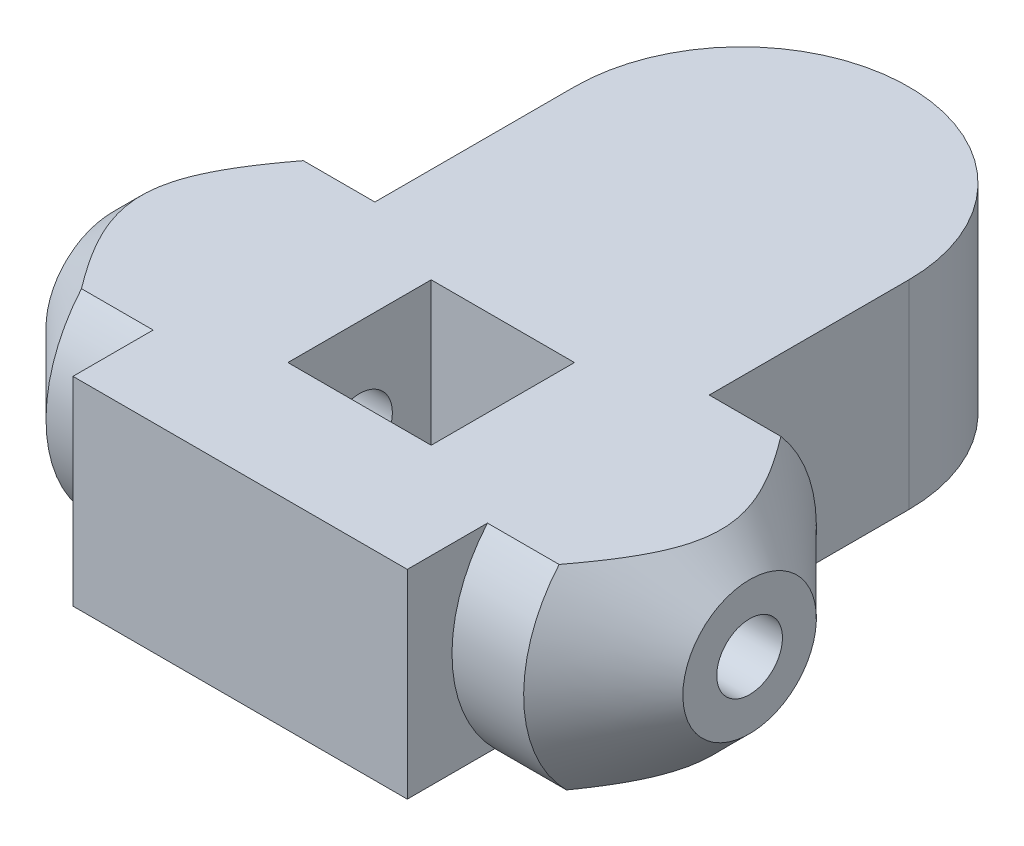
from build123d import *

# Parameters (mm, degrees)
BOSS_EXTRUDE1_DEPTH      = 12
BOSS_EXTRUDE1_DEPTH_BACK = 13
BOSS_EXTRUDE2_START      = -40
BOSS_EXTRUDE2_DEPTH      = 80
SKETCH2_W                = 18
SKETCH2_H                = 18
CUT_EXTRUDE1_DEPTH       = 20
CUT_EXTRUDE2_DEPTH       = 74.273460407
CUT_EXTRUDE2_DEPTH_BACK  = 74.273460407
SKETCH5_R                = 4.125
CHAMFER1_SIZE            = 10


# Read off the part's stored shape, not the designer's step: Boss-Extrude2
with BuildPart() as part:
    # Sketch1 → Boss-Extrude1 (new, two sides: drawn at the far end of the back side and taken through both)
    with BuildSketch(Plane(origin=(0, 0, 0), x_dir=(1, 0, 0), z_dir=(0, 1, 0)).offset(-BOSS_EXTRUDE1_DEPTH_BACK)):
        with BuildLine():
            Line((-21, -24), (21, -24))
            Line((21, -24), (21, 39))
            ThreePointArc((21, 39), (0, 60), (-21, 39))
            Line((-21, 39), (-21, -24))
        make_face()
    extrude(amount=BOSS_EXTRUDE1_DEPTH + BOSS_EXTRUDE1_DEPTH_BACK)

    # Boss-Extrude2 outline → Boss-Extrude2 (add)
    with BuildSketch(Plane(origin=(0, 0, 0), x_dir=(0, 0, -1), z_dir=(1, 0, 0)).offset(BOSS_EXTRUDE2_START)):
        with BuildLine():
            Line((-13, -13), (13, -13))
            ThreePointArc((13, -13), (18.372112666, -0.682258161), (13.928388277, 12))
            Line((13.928388277, 12), (-13.928388277, 12))
            ThreePointArc((-13.928388277, 12), (-18.372112666, -0.682258161), (-13, -13))
        make_face()
    extrude(amount=BOSS_EXTRUDE2_DEPTH)

    # Sketch2 → Cut-Extrude1 (cut)
    with BuildSketch(Plane(origin=(0, 12, 0), x_dir=(1, 0, 0), z_dir=(0, 1, 0))):
        Rectangle(SKETCH2_W, SKETCH2_H)
    extrude(amount=-CUT_EXTRUDE1_DEPTH, mode=Mode.SUBTRACT)

    # Sketch5 → Cut-Extrude2 (cut, two sides: drawn at the far end of the back side and taken through both)
    with BuildSketch(Plane(origin=(0, 0, 0), x_dir=(0, 0, -1), z_dir=(1, 0, 0)).offset(-CUT_EXTRUDE2_DEPTH_BACK)):
        Circle(SKETCH5_R)
    extrude(amount=CUT_EXTRUDE2_DEPTH + CUT_EXTRUDE2_DEPTH_BACK, mode=Mode.SUBTRACT)

    # Chamfer1
    # the kernel refuses this chamfer: 10 mm, written as the material it takes off along each edge
    with BuildSketch(Plane(origin=(40, 0, -1e-09), x_dir=(0, -0.8173943471187031, 0.5760785374394618), z_dir=(0, 0.5760785374394618, 0.8173943471187031))) as chamfer1_piece_1:
        Polygon((18.38477631 - CHAMFER1_SIZE, 0), (18.38477631, -CHAMFER1_SIZE), (18.38477631, 0), align=None)
    revolve(axis=Axis((40, 0, -1e-09), (1, 0, 0)), revolution_arc=246.096931862, mode=Mode.SUBTRACT)
    with BuildSketch(Plane(origin=(40, 0, 1e-09), x_dir=(0, 0.8578700425310862, -0.5138667046304052), z_dir=(0, -0.5138667046304052, -0.8578700425310862))) as chamfer1_piece_2:
        Polygon((18.38477631, -CHAMFER1_SIZE), (18.38477631 - CHAMFER1_SIZE, 0), (18.38477631, 0), align=None)
    revolve(axis=Axis((40, 0, 1e-09), (1, 0, 0)), revolution_arc=246.096931862, mode=Mode.SUBTRACT)
    with BuildSketch(Plane(origin=(-40, 0, 1e-09), x_dir=(0, 0.8578700425310862, -0.5138667046304052), z_dir=(0, -0.5138667046304052, -0.8578700425310862))) as chamfer1_piece_3:
        Polygon((18.38477631, CHAMFER1_SIZE), (18.38477631 - CHAMFER1_SIZE, 0), (18.38477631, 0), align=None)
    revolve(axis=Axis((-40, 0, 1e-09), (1, 0, 0)), revolution_arc=246.096931862, mode=Mode.SUBTRACT)
    with BuildSketch(Plane(origin=(-40, 0, -1e-09), x_dir=(0, -0.8173943471187031, 0.5760785374394618), z_dir=(0, 0.5760785374394618, 0.8173943471187031))) as chamfer1_piece_4:
        Polygon((18.38477631 - CHAMFER1_SIZE, 0), (18.38477631, CHAMFER1_SIZE), (18.38477631, 0), align=None)
    revolve(axis=Axis((-40, 0, -1e-09), (1, 0, 0)), revolution_arc=246.096931862, mode=Mode.SUBTRACT)


solid = part.part
